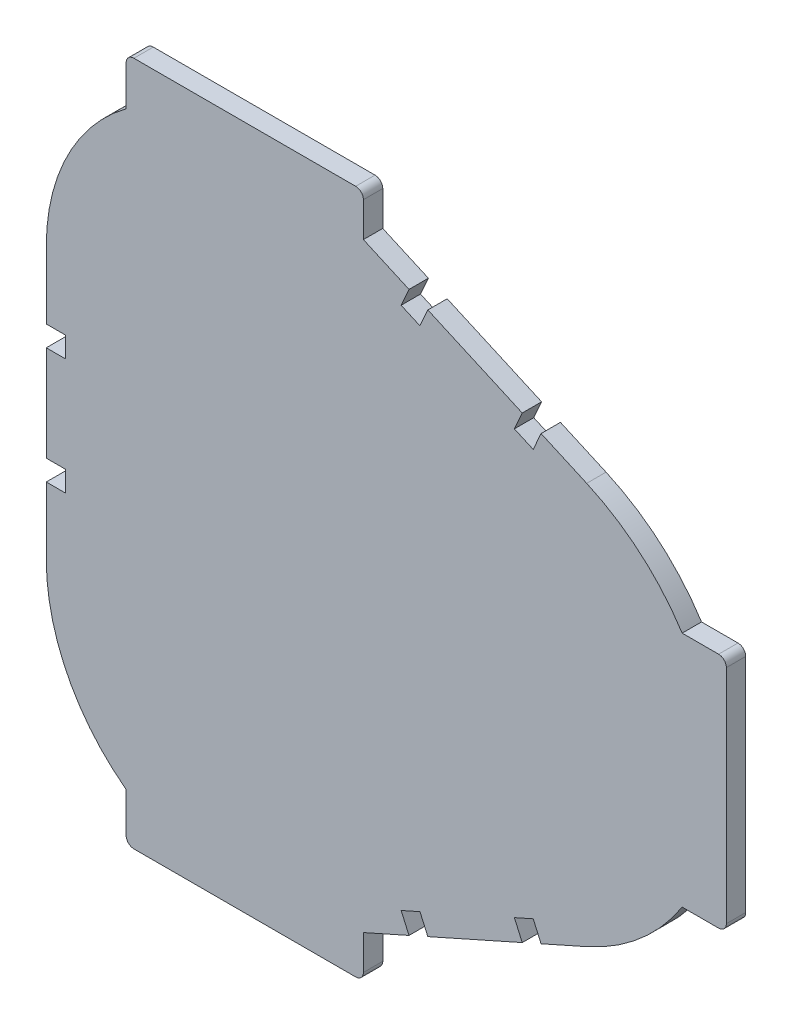
from build123d import *

# Parameters (mm, degrees)
BOSS_EXTRUDE1_DEPTH = 6.35


with BuildPart() as part:
    # Sketch1 → Boss-Extrude1 (new body)
    with BuildSketch(Plane(origin=(0, 0, -130.81), x_dir=(-1, 0, 0), z_dir=(0, 0, -1))):
        with BuildLine():
            Line((83.226798569, 59.314378099), (83.226798569, 81.336178099))
            ThreePointArc((83.226798569, 81.336178099), (76.310939467, 110.532802074), (57.033048569, 133.52486334))
            Line((57.033048569, 133.52486334), (57.033048569, 146.599312576))
            ThreePointArc((57.033048569, 146.599312576), (56.289099793, 148.3953638), (54.493048569, 149.139312576))
            Line((54.493048569, 149.139312576), (-18.214451431, 149.139312576))
            ThreePointArc((-18.214451431, 149.139312576), (-20.010502655, 148.3953638), (-20.754451431, 146.599312576))
            Line((-20.754451431, 146.599312576), (-20.754451431, 135.265698217))
            Line((-20.754451431, 135.265698217), (-35.707221998, 128.607085142))
            Line((-35.707221998, 128.607085142), (-33.124052341, 122.80624602))
            Line((-33.124052341, 122.80624602), (-39.296145167, 120.057753504))
            Line((-39.296145167, 120.057753504), (-41.879314824, 125.858592626))
            Line((-41.879314824, 125.858592626), (-72.83259238, 112.074799335))
            Line((-72.83259238, 112.074799335), (-70.249422723, 106.273960213))
            Line((-70.249422723, 106.273960213), (-76.421515549, 103.525467697))
            Line((-76.421515549, 103.525467697), (-79.004685206, 109.326306819))
            Line((-79.004685206, 109.326306819), (-93.957455774, 102.667693744))
            ThreePointArc((-93.957455774, 102.667693744), (-111.579245978, 91.514788164), (-125.266063418, 75.779928099))
            Line((-125.266063418, 75.779928099), (-137.21728746, 75.779928099))
            ThreePointArc((-137.21728746, 75.779928099), (-139.013338684, 75.035979323), (-139.75728746, 73.239928099))
            Line((-139.75728746, 73.239928099), (-139.75728746, 0.532428099))
            ThreePointArc((-139.75728746, 0.532428099), (-139.013338684, -1.263623125), (-137.21728746, -2.007571901))
            Line((-137.21728746, -2.007571901), (-125.266063418, -2.007571901))
            ThreePointArc((-125.266063418, -2.007571901), (-111.579245978, -17.742431966), (-93.957455774, -28.895337546))
            Line((-93.957455774, -28.895337546), (-79.004685206, -35.553950621))
            Line((-79.004685206, -35.553950621), (-76.421515549, -29.753111499))
            Line((-76.421515549, -29.753111499), (-70.249422723, -32.501604014))
            Line((-70.249422723, -32.501604014), (-72.83259238, -38.302443137))
            Line((-72.83259238, -38.302443137), (-41.879314824, -52.086236428))
            Line((-41.879314824, -52.086236428), (-39.296145167, -46.285397306))
            Line((-39.296145167, -46.285397306), (-33.124052341, -49.033889822))
            Line((-33.124052341, -49.033889822), (-35.707221998, -54.834728944))
            Line((-35.707221998, -54.834728944), (-20.754451431, -61.493342019))
            Line((-20.754451431, -61.493342019), (-20.754451431, -72.826956378))
            ThreePointArc((-20.754451431, -72.826956378), (-20.010502655, -74.623007602), (-18.214451431, -75.366956378))
            Line((-18.214451431, -75.366956378), (54.493048569, -75.366956378))
            ThreePointArc((54.493048569, -75.366956378), (56.289099793, -74.623007602), (57.033048569, -72.826956378))
            Line((57.033048569, -72.826956378), (57.033048569, -59.752507142))
            ThreePointArc((57.033048569, -59.752507142), (76.310939467, -36.760445876), (83.226798569, -7.563821901))
            Line((83.226798569, -7.563821901), (83.226798569, 14.457978099))
            Line((83.226798569, 14.457978099), (76.876798569, 14.457978099))
            Line((76.876798569, 14.457978099), (76.876798569, 21.214378099))
            Line((76.876798569, 21.214378099), (83.226798569, 21.214378099))
            Line((83.226798569, 21.214378099), (83.226798569, 52.557978099))
            Line((83.226798569, 52.557978099), (76.876798569, 52.557978099))
            Line((76.876798569, 52.557978099), (76.876798569, 59.314378099))
            Line((76.876798569, 59.314378099), (83.226798569, 59.314378099))
        make_face()
    extrude(amount=BOSS_EXTRUDE1_DEPTH)


solid = part.part
